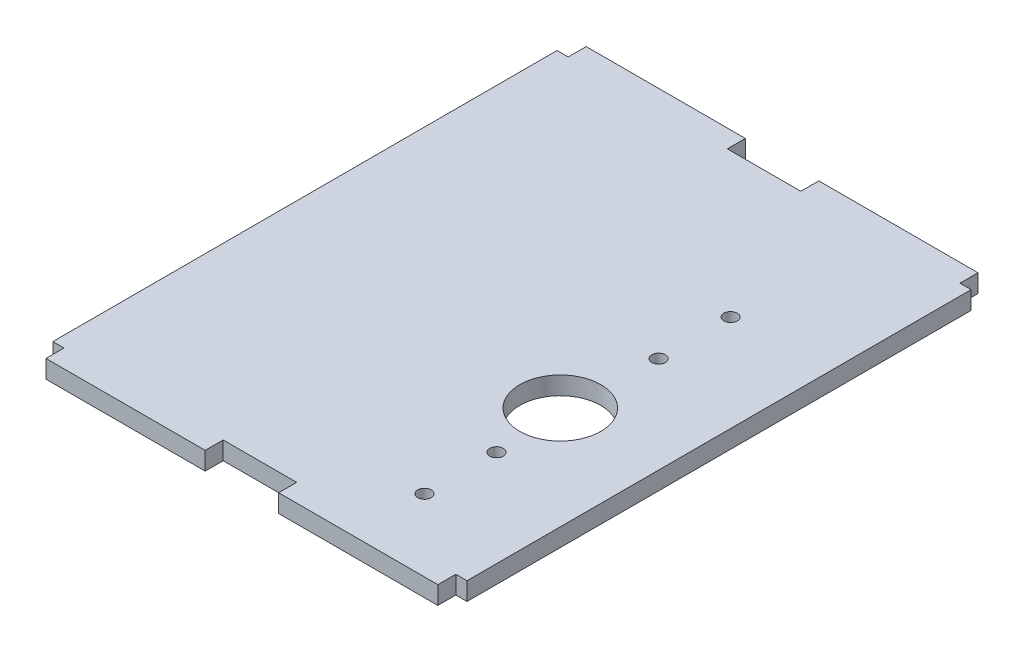
from build123d import *

# Parameters (mm, degrees)
SKETCH1_W           = 292.1
SKETCH1_H           = 355.6
SKETCH1_RX          = 28.575
SKETCH1_RY          = 28.573991153
BOSS_EXTRUDE1_DEPTH = 12.7
SKETCH2_R           = 4.7625
CUT_EXTRUDE1_DEPTH  = 12.7
SKETCH3_W           = 112.268
SKETCH3_H           = 12.7
BOSS_EXTRUDE2_DEPTH = 12.7


with BuildPart() as part:
    # Sketch1 → Boss-Extrude1 (new body)
    with BuildSketch(Plane(origin=(0, 0, 0), x_dir=(1, 0, 0), z_dir=(0, 1, 0))):
        with Locations((146.05, 177.8)):
            Rectangle(SKETCH1_W, SKETCH1_H)
        with Locations(Location((219.512197498, 138.386094447), (0, 0, 0))):
            Ellipse(SKETCH1_RX, SKETCH1_RY, mode=Mode.SUBTRACT)
    extrude(amount=BOSS_EXTRUDE1_DEPTH)

    # Sketch2 → Cut-Extrude1 (cut)
    with BuildSketch(Plane.XZ):
        with Locations((224.028, -38.1)):
            Circle(SKETCH2_R)
        with Locations((224.028, -88.9)):
            Circle(SKETCH2_R)
        with Locations((224.028, -203.2)):
            Circle(SKETCH2_R)
        with Locations((224.028, -254)):
            Circle(SKETCH2_R)
    extrude(amount=-CUT_EXTRUDE1_DEPTH, mode=Mode.SUBTRACT)

    # Sketch3 → Boss-Extrude2 (add)
    with BuildSketch(Plane(origin=(0, 12.7, 0), x_dir=(1, 0, 0), z_dir=(0, 1, 0))):
        with Locations((64.008, 361.95)):
            Rectangle(SKETCH3_W, SKETCH3_H)
        with Locations((228.092, 361.95)):
            Rectangle(SKETCH3_W, SKETCH3_H)
        with Locations((228.092, -6.35)):
            Rectangle(SKETCH3_W, SKETCH3_H)
        with Locations((64.008, -6.35)):
            Rectangle(SKETCH3_W, SKETCH3_H)
    extrude(amount=-BOSS_EXTRUDE2_DEPTH)


solid = part.part
